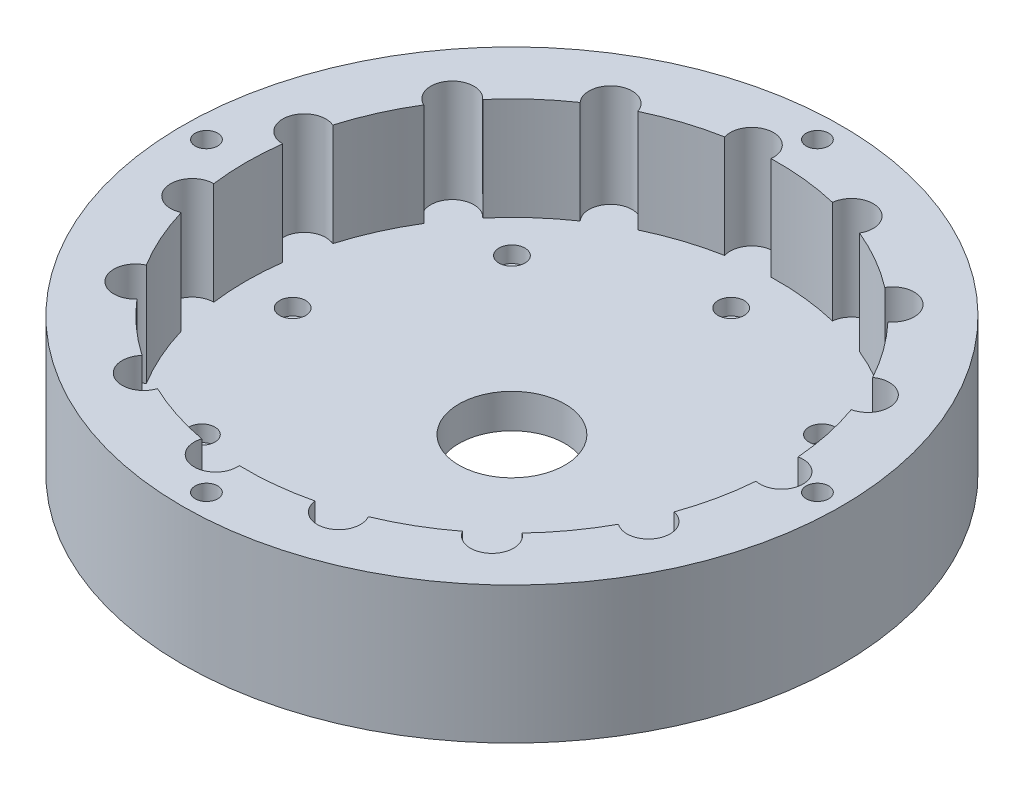
from build123d import *

# Parameters (mm, degrees)
SKETCH1_R           = 45.85
SKETCH1_R_2         = 1.5635
SKETCH1_R_3         = 7.375
BOSS_EXTRUDE1_DEPTH = 4.7625
SKETCH1_6_R         = 1.8125
CUT_EXTRUDE1_DEPTH  = 2.2467
BOSS_EXTRUDE2_START = 14.2875
SKETCH1_7_R         = 45.85
SKETCH1_7_R_2       = 1.5635
BOSS_EXTRUDE2_DEPTH = 14.2875


with BuildPart() as part:
    # Sketch1 → Boss-Extrude1 (new body)
    with BuildSketch(Plane(origin=(0, 0, 0), x_dir=(1, 0, 0), z_dir=(0, 1, 0))):
        Circle(SKETCH1_R)
        with Locations((0, -42.5)):
            Circle(SKETCH1_R_2, mode=Mode.SUBTRACT)
        with Locations((-42.5, 0)):
            Circle(SKETCH1_R_2, mode=Mode.SUBTRACT)
        with Locations((42.5, 0)):
            Circle(SKETCH1_R_2, mode=Mode.SUBTRACT)
        with Locations((0, 42.5)):
            Circle(SKETCH1_R_2, mode=Mode.SUBTRACT)
        Circle(SKETCH1_R_3, mode=Mode.SUBTRACT)
    extrude(amount=-BOSS_EXTRUDE1_DEPTH)

    # Sketch1<6> → Cut-Extrude1 (cut)
    with BuildSketch(Plane(origin=(0, 0, 0), x_dir=(1, 0, 0), z_dir=(0, 1, 0))):
        with Locations((30.5, 0)):
            Circle(SKETCH1_6_R)
        with Locations((21.566756826, -21.566756826)):
            Circle(SKETCH1_6_R)
        with Locations((0, -30.5)):
            Circle(SKETCH1_6_R)
        with Locations((-21.566756826, -21.566756826)):
            Circle(SKETCH1_6_R)
        with Locations((-30.5, 0)):
            Circle(SKETCH1_6_R)
        with Locations((-21.566756826, 21.566756826)):
            Circle(SKETCH1_6_R)
        with Locations((0, 30.5)):
            Circle(SKETCH1_6_R)
        with Locations((21.566756826, 21.566756826)):
            Circle(SKETCH1_6_R)
    extrude(amount=-CUT_EXTRUDE1_DEPTH, mode=Mode.SUBTRACT)

    # Sketch1<7> → Boss-Extrude2 (add)
    with BuildSketch(Plane(origin=(0, 0, 0), x_dir=(1, 0, 0), z_dir=(0, 1, 0)).offset(BOSS_EXTRUDE2_START)):
        Circle(SKETCH1_7_R)
        with Locations((0, -42.5)):
            Circle(SKETCH1_7_R_2, mode=Mode.SUBTRACT)
        with Locations((-42.5, 0)):
            Circle(SKETCH1_7_R_2, mode=Mode.SUBTRACT)
        with Locations((42.5, 0)):
            Circle(SKETCH1_7_R_2, mode=Mode.SUBTRACT)
        with BuildLine():
            ThreePointArc((36.883333333, 2.935936345), (39.39076704, 2.32916294), (40.5, 0))
            ThreePointArc((40.5, 0), (39.39076704, -2.32916294), (36.883333333, -2.935936345))
            ThreePointArc((36.883333333, -2.935936345), (36.191461227, -7.69273256), (34.888754523, -12.319691873))
            ThreePointArc((34.888754523, -12.319691873), (36.59166411, -13.367471546), (37.257954662, -15.252624115))
            ThreePointArc((37.257954662, -15.252624115), (35.6231437, -17.924001829), (32.500448736, -17.683914497))
            ThreePointArc((32.500448736, -17.683914497), (29.933628792, -21.748054335), (26.861593101, -25.445133446))
            ThreePointArc((26.861593101, -25.445133446), (27.767055295, -26.50917897), (28.092397738, -27.867930955))
            ThreePointArc((28.092397738, -27.867930955), (25.872343464, -30.764771418), (22.497941295, -29.37418318))
            ThreePointArc((22.497941295, -29.37418318), (18.5, -32.04293994), (14.189818202, -34.170880284))
            ThreePointArc((14.189818202, -34.170880284), (14.486847583, -34.891651942), (14.588137289, -35.664619361))
            ThreePointArc((14.588137289, -35.664619361), (11.748752331, -38.660316744), (8.605335417, -35.985388734))
            ThreePointArc((8.605335417, -35.985388734), (3.867553141, -36.797310129), (-0.935505175, -36.988171489))
            ThreePointArc((-0.935505175, -36.988171489), (-0.92374189, -37.141170608), (-0.919817373, -37.294571076))
            ThreePointArc((-0.919817373, -37.294571076), (-4.385552663, -40.258199029), (-6.775211132, -36.37439366))
            ThreePointArc((-6.775211132, -36.37439366), (-11.433628792, -35.189091103), (-15.899071208, -33.409871815))
            ThreePointArc((-15.899071208, -33.409871815), (-20.25, -35.074028853), (-20.984262125, -30.47393547))
            ThreePointArc((-20.984262125, -30.47393547), (-24.757832435, -27.496358543), (-28.113543391, -24.054701786))
            ThreePointArc((-28.113543391, -24.054701786), (-32.765188272, -23.805302718), (-31.564943561, -19.304256991))
            ThreePointArc((-31.564943561, -19.304256991), (-33.801181933, -15.049255794), (-35.466928517, -10.540255288))
            ThreePointArc((-35.466928517, -10.540255288), (-39.61497783, -8.420423478), (-36.687759497, -4.796697105))
            ThreePointArc((-36.687759497, -4.796697105), (-37, 0), (-36.687759497, 4.796697105))
            ThreePointArc((-36.687759497, 4.796697105), (-39.61497783, 8.420423478), (-35.466928517, 10.540255288))
            ThreePointArc((-35.466928517, 10.540255288), (-33.801181933, 15.049255794), (-31.564943561, 19.304256991))
            ThreePointArc((-31.564943561, 19.304256991), (-32.765188272, 23.805302718), (-28.113543391, 24.054701786))
            ThreePointArc((-28.113543391, 24.054701786), (-24.757832435, 27.496358543), (-20.984262125, 30.47393547))
            ThreePointArc((-20.984262125, 30.47393547), (-20.25, 35.074028853), (-15.899071208, 33.409871815))
            ThreePointArc((-15.899071208, 33.409871815), (-11.433628792, 35.189091103), (-6.775211132, 36.37439366))
            ThreePointArc((-6.775211132, 36.37439366), (-4.385552663, 40.258199029), (-0.919817373, 37.294571076))
            ThreePointArc((-0.919817373, 37.294571076), (-0.92374189, 37.141170608), (-0.935505175, 36.988171489))
            ThreePointArc((-0.935505175, 36.988171489), (3.867553141, 36.797310129), (8.605335417, 35.985388734))
            ThreePointArc((8.605335417, 35.985388734), (11.748752331, 38.660316744), (14.588137289, 35.664619361))
            ThreePointArc((14.588137289, 35.664619361), (14.486847583, 34.891651942), (14.189818202, 34.170880284))
            ThreePointArc((14.189818202, 34.170880284), (18.5, 32.04293994), (22.497941295, 29.37418318))
            ThreePointArc((22.497941295, 29.37418318), (25.872343464, 30.764771418), (28.092397738, 27.867930955))
            ThreePointArc((28.092397738, 27.867930955), (27.767055295, 26.50917897), (26.861593101, 25.445133446))
            ThreePointArc((26.861593101, 25.445133446), (29.933628792, 21.748054335), (32.500448736, 17.683914497))
            ThreePointArc((32.500448736, 17.683914497), (35.6231437, 17.924001829), (37.257954662, 15.252624115))
            ThreePointArc((37.257954662, 15.252624115), (36.59166411, 13.367471546), (34.888754523, 12.319691873))
            ThreePointArc((34.888754523, 12.319691873), (36.191461227, 7.69273256), (36.883333333, 2.935936345))
        make_face(mode=Mode.SUBTRACT)
        with Locations((0, 42.5)):
            Circle(SKETCH1_7_R_2, mode=Mode.SUBTRACT)
    extrude(amount=-BOSS_EXTRUDE2_DEPTH)


solid = part.part
